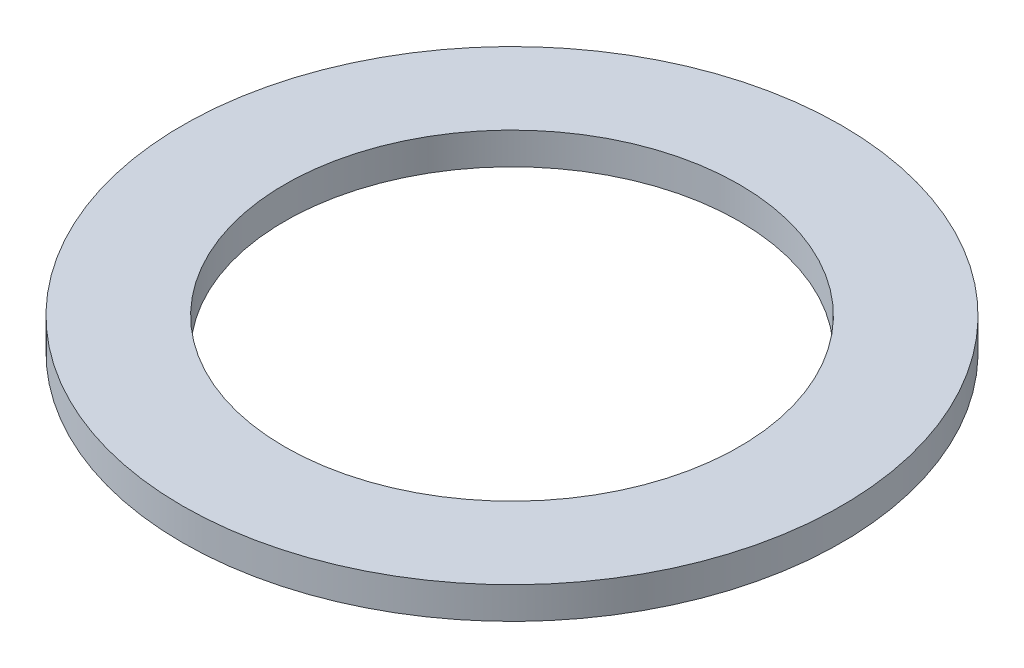
from build123d import *

# Parameters (mm, degrees)
SKETCH1_R           = 72.5
BOSS_EXTRUDE1_DEPTH = 7
SKETCH2_R           = 50
CUT_EXTRUDE1_DEPTH  = 103.769158798


with BuildPart() as part:
    # Sketch1 → Boss-Extrude1 (new body)
    with BuildSketch(Plane(origin=(0, 0, 0), x_dir=(1, 0, 0), z_dir=(0, 1, 0))):
        Circle(SKETCH1_R)
    extrude(amount=BOSS_EXTRUDE1_DEPTH)

    # Sketch2 → Cut-Extrude1 (cut, through all)
    with BuildSketch(Plane(origin=(0, 0, 0), x_dir=(1, 0, 0), z_dir=(0, 1, 0))):
        Circle(SKETCH2_R)
    extrude(amount=CUT_EXTRUDE1_DEPTH, mode=Mode.SUBTRACT)


solid = part.part
